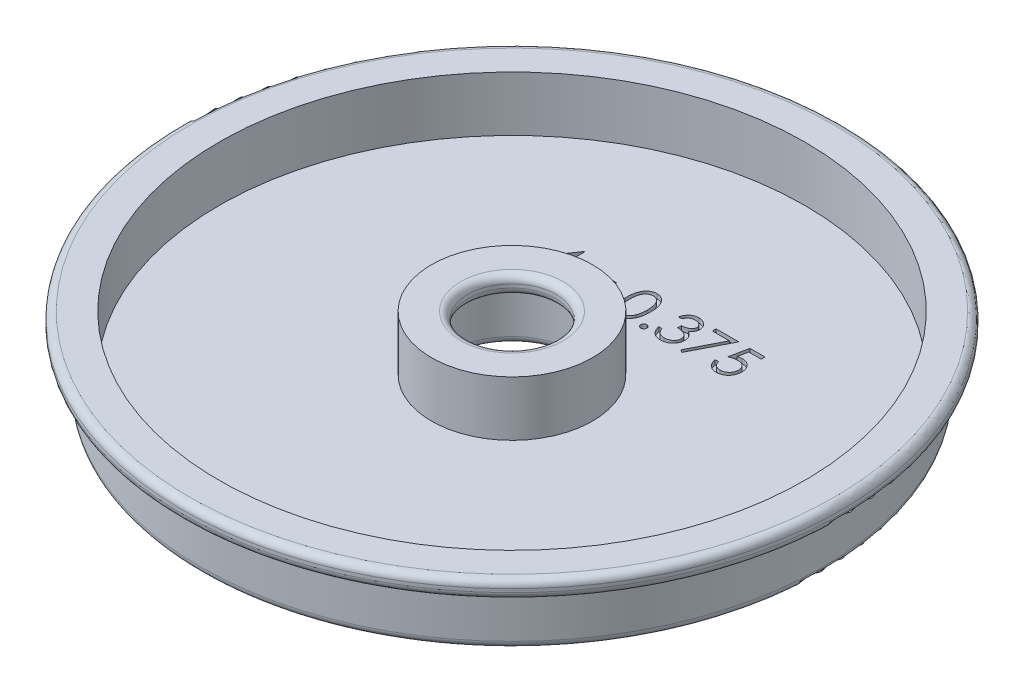
from build123d import *

# Parameters (mm, degrees)
CUT_EXTRUDE1_DEPTH = 0.79375


with BuildPart() as part:
    # Sketch1 → Revolve2 (revolve)
    with BuildSketch(Plane.XY):
        with BuildLine():
            Line((13.97, 6.386825196), (13.97, 15.911825196))
            Line((13.97, 15.911825196), (8.89, 15.911825196))
            ThreePointArc((8.89, 15.911825196), (7.991974388, 15.539850808), (7.62, 14.641825196))
            Line((7.62, 14.641825196), (7.62, 14.006825196))
            ThreePointArc((7.62, 14.006825196), (7.991974388, 13.108799584), (8.89, 12.736825196))
            Line((8.89, 12.736825196), (9.525, 12.736825196))
            ThreePointArc((9.525, 12.736825196), (10.423025612, 12.364850808), (10.795, 11.466825196))
            Line((10.795, 11.466825196), (10.795, 4.481825196))
            ThreePointArc((10.795, 4.481825196), (11.166974388, 3.583799584), (12.065, 3.211825196))
            Line((12.065, 3.211825196), (52.705, 3.211825196))
            ThreePointArc((52.705, 3.211825196), (53.603025612, 3.583799584), (53.975, 4.481825196))
            Line((53.975, 4.481825196), (53.975, 11.503650391))
            ThreePointArc((53.975, 11.503650391), (54.346974388, 12.401676004), (55.245, 12.773650391))
            Line((55.245, 12.773650391), (55.88, 12.773650391))
            ThreePointArc((55.88, 12.773650391), (56.778025612, 13.145624779), (57.15, 14.043650391))
            Line((57.15, 14.043650391), (57.15, 14.641825196))
            ThreePointArc((57.15, 14.641825196), (56.778025612, 15.539850808), (55.88, 15.911825196))
            Line((55.88, 15.911825196), (50.8, 15.911825196))
            Line((50.8, 15.911825196), (50.8, 6.386825196))
            Line((50.8, 6.386825196), (13.97, 6.386825196))
        make_face()
    revolve(axis=Axis((0, 0, 0), (0, 1, 0)))

    # Sketch2 → Cut-Extrude1 (cut)
    # profile 1 of 7: a face of its own
    with BuildSketch(Plane(origin=(0, 6.386825196, 0), x_dir=(1, 0, 0), z_dir=(0, 1, 0))):
        Polygon((-12.245035979, 24.737791059), (-12.129280771, 24.737791059), (-12.129280771, 20.341637213), (-11.396588463, 20.341637213), (-11.396588463, 19.690355162), (-12.129280771, 19.690355162), (-12.129280771, 18.224970546), (-12.699152566, 18.224970546), (-12.699152566, 19.690355162), (-15.711332053, 19.690355162), align=None)
        Polygon((-12.699152566, 20.341637213), (-12.699152566, 23.099409649), (-14.591941027, 20.341637213), align=None, mode=Mode.SUBTRACT)
    # profile 2 of 7: a face of its own
    with BuildSketch(Plane(origin=(0, 6.386825196, 0), x_dir=(1, 0, 0), z_dir=(0, 1, 0))):
        Polygon((-8.384408976, 22.865355162), (-7.706414185, 22.865355162), (-6.511973079, 21.191356764), (-5.317531973, 22.865355162), (-4.639537181, 22.865355162), (-6.172339665, 20.716887614), (-4.395306412, 18.224970546), (-5.073301204, 18.224970546), (-6.511973079, 20.241146428), (-7.950644954, 18.224970546), (-8.628639745, 18.224970546), (-6.850334457, 20.716887614), align=None)
    # profile 3 of 7: a face of its own
    with BuildSketch(Plane(origin=(0, 6.386825196, 0), x_dir=(1, 0, 0), z_dir=(0, 1, 0))):
        with BuildLine():
            add(Edge.make_bspline(
                [(-1.708767951, 21.397426476), (-1.708172832, 21.499203165), (-1.707016805, 21.696905851), (-1.694156384, 21.984986558), (-1.672792549, 22.255243083), (-1.643514744, 22.50768836), (-1.607885837, 22.742387561), (-1.560323454, 22.958713478), (-1.506234512, 23.157667335), (-1.443546504, 23.339897909), (-1.372811515, 23.507860313), (-1.295823642, 23.664660321), (-1.209527515, 23.810060684), (-1.118855116, 23.946382104), (-1.020136071, 24.071393093), (-0.916179694, 24.186859066), (-0.802928576, 24.290111428), (-0.684232547, 24.384175434), (-0.559016961, 24.466633761), (-0.430850981, 24.539264587), (-0.298852432, 24.601312917), (-0.162660929, 24.650099851), (-0.023500574, 24.690396673), (0.119115104, 24.717953764), (0.265421579, 24.735292726), (0.364175753, 24.73695038), (0.414258892, 24.737791059)],
                knots=[0, 0, 0, 0, 1.646270934, 3.197905019, 4.663502075, 6.030701355, 7.308322542, 8.50163776, 9.611534131, 10.641858119, 11.616356847, 12.558055219, 13.465016945, 14.349605745, 15.204443733, 16.039544428, 16.859896111, 17.680448484, 18.487036065, 19.28249412, 20.06191084, 20.843045899, 21.620316918, 22.403196591, 23.190181807, 24, 24, 24, 24], degree=3))
            add(Edge.make_bspline(
                [(0.414258892, 24.737791059), (0.464760403, 24.736906023), (0.565192019, 24.735145965), (0.713673843, 24.718229669), (0.858725409, 24.690160631), (0.999728317, 24.65038972), (1.137840793, 24.601048993), (1.271982561, 24.539205223), (1.402986838, 24.467216421), (1.528771788, 24.382627386), (1.650718304, 24.288316685), (1.765831037, 24.181704415), (1.874120464, 24.063867067), (1.976945661, 23.936065399), (2.071389388, 23.795848174), (2.161329758, 23.645654146), (2.241833308, 23.48285672), (2.319366219, 23.310172157), (2.386289752, 23.122822376), (2.446644226, 22.921863453), (2.495410354, 22.704921714), (2.536030891, 22.473135384), (2.567499488, 22.225653236), (2.59041871, 21.963005777), (2.602525593, 21.685020212), (2.604805608, 21.494959542), (2.605975639, 21.397426476)],
                knots=[0, 0, 0, 0, 0.810914788, 1.612654377, 2.396697861, 3.181598691, 3.963628158, 4.749916497, 5.551656086, 6.361998678, 7.18212741, 8.025565596, 8.878627764, 9.750805457, 10.657531673, 11.591944965, 12.560506719, 13.57287815, 14.630710178, 15.753379473, 16.941251878, 18.199788006, 19.531962791, 20.947069417, 22.433333509, 24, 24, 24, 24], degree=3))
            add(Edge.make_bspline(
                [(2.605975639, 21.397426476), (2.604793479, 21.300318814), (2.602490087, 21.111108496), (2.590554433, 20.834373726), (2.567043774, 20.573120134), (2.537634224, 20.326721152), (2.496901762, 20.096202329), (2.446818104, 19.880765972), (2.391209661, 19.679481728), (2.322566534, 19.49399857), (2.247435674, 19.321729016), (2.165692675, 19.160861475), (2.078117419, 19.009974058), (1.982706411, 18.870274517), (1.881009504, 18.74077324), (1.770850087, 18.623756124), (1.655333454, 18.516403619), (1.533028071, 18.420878524), (1.405281399, 18.337267521), (1.274727074, 18.262493821), (1.13904865, 18.202200217), (1.001320864, 18.1504295), (0.859573686, 18.110877252), (0.713983806, 18.083528971), (0.565291778, 18.064348617), (0.46477751, 18.062885432), (0.414258892, 18.062150033)],
                knots=[0, 0, 0, 0, 1.561518951, 3.042555995, 4.452378317, 5.7783523, 7.031515105, 8.214008947, 9.334062868, 10.386615937, 11.391082383, 12.354592575, 13.286541444, 14.194233754, 15.072674879, 15.931287219, 16.775624067, 17.606195743, 18.42308326, 19.229000347, 20.022332153, 20.807536673, 21.593273796, 22.3848459, 23.188221202, 24, 24, 24, 24], degree=3))
            add(Edge.make_bspline(
                [(0.414258892, 18.062150033), (0.364177143, 18.062996136), (0.265425708, 18.064664484), (0.119099165, 18.081925111), (-0.022927554, 18.109675524), (-0.161355294, 18.148531363), (-0.296894257, 18.196092566), (-0.42769752, 18.258057106), (-0.55521946, 18.329420345), (-0.679119855, 18.410692038), (-0.79707049, 18.503804235), (-0.909735102, 18.606790873), (-1.014283351, 18.722221919), (-1.111590925, 18.848274723), (-1.204072485, 18.983789605), (-1.289143205, 19.130616796), (-1.367830326, 19.288174104), (-1.439754945, 19.457479456), (-1.503524663, 19.641003397), (-1.559854076, 19.840845478), (-1.604329762, 20.05876956), (-1.642398838, 20.293025355), (-1.673104504, 20.544619486), (-1.694067351, 20.81368854), (-1.707023737, 21.100064848), (-1.708175937, 21.296497153), (-1.708767951, 21.397426476)],
                knots=[0, 0, 0, 0, 0.810891512, 1.598919785, 2.382837074, 3.152667961, 3.926044502, 4.706494248, 5.493654104, 6.291793342, 7.103789334, 7.925228297, 8.761435821, 9.622817696, 10.50288917, 11.416980706, 12.369136599, 13.353924996, 14.394355917, 15.514179734, 16.714354668, 17.994756427, 19.357759367, 20.818452758, 22.365282078, 24, 24, 24, 24], degree=3))
        make_face()
        with BuildLine():
            add(Edge.make_bspline(
                [(-1.138896156, 21.399970546), (-1.138679445, 21.31515505), (-1.138258851, 21.150544826), (-1.127271173, 20.911343481), (-1.112302895, 20.68824017), (-1.092996541, 20.480951611), (-1.064325477, 20.290179445), (-1.032200305, 20.114611592), (-0.993105914, 19.955177176), (-0.946850667, 19.810782148), (-0.894165449, 19.678975981), (-0.836641953, 19.556328062), (-0.77484607, 19.441389549), (-0.70568704, 19.335192859), (-0.630366854, 19.237391676), (-0.550586798, 19.146254966), (-0.463369395, 19.064980442), (-0.342712605, 18.967504577), (-0.183424716, 18.866777006), (0.017272396, 18.779063386), (0.223499443, 18.723940929), (0.363473854, 18.716930972), (0.433339421, 18.713432085)],
                knots=[0, 0, 0, 0, 1.459021318, 2.831673884, 4.118529203, 5.306027144, 6.411944654, 7.436330062, 8.375795394, 9.233974572, 10.042671642, 10.816086306, 11.563610507, 12.285937304, 12.993564865, 13.685989202, 14.367179055, 15.041617293, 16.353048772, 17.594441528, 18.799311195, 20, 20, 20, 20], degree=3))
            add(Edge.make_bspline(
                [(0.433339421, 18.713432085), (0.503656911, 18.716330916), (0.644146712, 18.722122592), (0.84940374, 18.778000302), (1.04866723, 18.862309323), (1.204826322, 18.961999797), (1.323630365, 19.056938338), (1.40875119, 19.137882057), (1.486878049, 19.228516273), (1.560977242, 19.326304996), (1.628938708, 19.433116503), (1.690738972, 19.548437175), (1.747133046, 19.672587255), (1.779262315, 19.75925521), (1.795689181, 19.803566299)],
                knots=[0, 0, 0, 0, 1.353760809, 2.704726607, 4.075137775, 5.516104923, 6.260822281, 7.007110065, 7.778089737, 8.566572457, 9.372053459, 10.217411131, 11.088608312, 12, 12, 12, 12], degree=3))
            add(Edge.make_bspline(
                [(1.795689181, 19.803566299), (1.814833102, 19.86022597), (1.853703473, 19.975269399), (1.903799121, 20.153729168), (1.943251488, 20.340968468), (1.978745023, 20.535868323), (2.002971282, 20.739866066), (2.022470886, 20.952330505), (2.033956561, 21.173421834), (2.035380323, 21.323635604), (2.036103844, 21.399970546)],
                knots=[0, 0, 0, 0, 0.884706709, 1.796334032, 2.740027952, 3.714592787, 4.726048262, 5.777819803, 6.87074269, 8, 8, 8, 8], degree=3))
            add(Edge.make_bspline(
                [(2.036103844, 21.399970546), (2.035105644, 21.476293142), (2.03315295, 21.625596455), (2.025689001, 21.844250869), (2.006414802, 22.051928092), (1.985007829, 22.249522807), (1.953444299, 22.435941213), (1.919412278, 22.61274391), (1.873690079, 22.777740541), (1.824849916, 22.933514353), (1.768951055, 23.078295541), (1.707418223, 23.212759125), (1.641701604, 23.337554268), (1.570323539, 23.452338576), (1.494131371, 23.55762619), (1.411114103, 23.651306097), (1.324564741, 23.736281739), (1.203339275, 23.833278115), (1.044635921, 23.932177905), (0.847158818, 24.023192926), (0.641653506, 24.0754594), (0.502727382, 24.082828461), (0.433339421, 24.086509008)],
                knots=[0, 0, 0, 0, 1.31362396, 2.569729283, 3.763502607, 4.902122613, 5.988968491, 7.01645872, 7.998833611, 8.933434873, 9.825090667, 10.667526885, 11.477055099, 12.250526234, 12.991942729, 13.710640831, 14.402115721, 15.076753259, 16.378508321, 17.609869233, 18.806226677, 20, 20, 20, 20], degree=3))
            add(Edge.make_bspline(
                [(0.433339421, 24.086509008), (0.363107347, 24.082823383), (0.222515253, 24.07544542), (0.014873963, 24.02338766), (-0.184161075, 23.93264985), (-0.342444757, 23.832950546), (-0.46375477, 23.737993895), (-0.549176228, 23.6556499), (-0.629269998, 23.56557741), (-0.703052825, 23.466876793), (-0.772157667, 23.360803912), (-0.835623219, 23.246524296), (-0.89280466, 23.123458821), (-0.945572318, 22.991711859), (-0.991968662, 22.847329289), (-1.030239138, 22.688091258), (-1.06559422, 22.513081825), (-1.09062278, 22.321276432), (-1.112872737, 22.113935954), (-1.127171754, 21.890275677), (-1.138295606, 21.650673158), (-1.138691963, 21.485211828), (-1.138896156, 21.399970546)],
                knots=[0, 0, 0, 0, 1.207732386, 2.417664972, 3.655092373, 4.956220595, 5.625982001, 6.301752483, 6.994047911, 7.697131622, 8.419323945, 9.170223765, 9.943494443, 10.752040957, 11.610060368, 12.549350801, 13.567764191, 14.679664412, 15.874934091, 17.154273443, 18.533957287, 20, 20, 20, 20], degree=3))
        make_face(mode=Mode.SUBTRACT)
    # profile 4 of 7: a face of its own
    with BuildSketch(Plane(origin=(0, 6.386825196, 0), x_dir=(1, 0, 0), z_dir=(0, 1, 0))):
        with BuildLine():
            add(Edge.make_bspline(
                [(4.193475639, 19.201893623), (4.228836453, 19.199792378), (4.298157194, 19.195673132), (4.398376755, 19.167412596), (4.489081352, 19.117231883), (4.569875567, 19.050352271), (4.636471603, 18.969261568), (4.688440642, 18.879280419), (4.716455001, 18.778221815), (4.720544241, 18.708499405), (4.722642306, 18.672726957)],
                knots=[0, 0, 0, 0, 1.020151414, 1.999887582, 2.974338812, 3.990962822, 5.007586832, 5.987933904, 6.967670073, 8, 8, 8, 8], degree=3))
            add(Edge.make_bspline(
                [(4.722642306, 18.672726957), (4.720473145, 18.637814058), (4.71619559, 18.568966336), (4.688504858, 18.468669968), (4.636075539, 18.378632584), (4.570334909, 18.296441562), (4.489061379, 18.229420268), (4.398162315, 18.179666485), (4.298392461, 18.149382465), (4.228875703, 18.145524754), (4.193475639, 18.14356029)],
                knots=[0, 0, 0, 0, 1.009421747, 1.99056486, 2.972319754, 3.999869655, 5.017953583, 5.993804169, 6.978383603, 8, 8, 8, 8], degree=3))
            add(Edge.make_bspline(
                [(4.193475639, 18.14356029), (4.158050068, 18.145453673), (4.088890072, 18.149150054), (3.989492625, 18.180288288), (3.898039982, 18.228953709), (3.816782277, 18.29656653), (3.75049105, 18.378209648), (3.700370712, 18.46929005), (3.670271442, 18.568679229), (3.666312902, 18.63775751), (3.664308973, 18.672726957)],
                knots=[0, 0, 0, 0, 1.022052826, 1.995314843, 2.982371812, 4.00089066, 5.028879526, 6.005146991, 6.990147033, 8, 8, 8, 8], degree=3))
            add(Edge.make_bspline(
                [(3.664308973, 18.672726957), (3.666235924, 18.708557974), (3.66999806, 18.778513638), (3.700433901, 18.87866059), (3.750102171, 18.969680473), (3.817240531, 19.050228554), (3.898020325, 19.117696946), (3.989272011, 19.166800213), (4.089129463, 19.195902104), (4.158090351, 19.199861813), (4.193475639, 19.201893623)],
                knots=[0, 0, 0, 0, 1.032775665, 2.016367738, 2.991239715, 4.008302682, 5.025365648, 6.011011707, 6.979408107, 8, 8, 8, 8], degree=3))
        make_face()
    # profile 5 of 7: a face of its own
    with BuildSketch(Plane(origin=(0, 6.386825196, 0), x_dir=(1, 0, 0), z_dir=(0, 1, 0))):
        with BuildLine():
            Line((6.350847434, 23.109585931), (5.780975639, 23.109585931))
            add(Edge.make_bspline(
                [(5.780975639, 23.109585931), (5.796414395, 23.173507723), (5.826595901, 23.298469599), (5.889547213, 23.477008486), (5.958125862, 23.645961161), (6.040474666, 23.802164038), (6.130297691, 23.948756333), (6.233208915, 24.082413173), (6.344460411, 24.206533839), (6.467514248, 24.316684998), (6.596561962, 24.416430307), (6.733421915, 24.501475054), (6.875340594, 24.574634588), (7.023301278, 24.63490558), (7.177744475, 24.68030903), (7.337273935, 24.713250663), (7.502307713, 24.734643113), (7.614335485, 24.736730926), (7.67122003, 24.737791059)],
                knots=[0, 0, 0, 0, 1.162005537, 2.271625781, 3.343758855, 4.383309926, 5.390229558, 6.379919256, 7.361854164, 8.333198761, 9.295911338, 10.242430842, 11.177959212, 12.116337295, 13.062827104, 14.020064771, 14.994644689, 16, 16, 16, 16], degree=3))
            add(Edge.make_bspline(
                [(7.67122003, 24.737791059), (7.754101577, 24.735288741), (7.918056782, 24.730338689), (8.158926882, 24.685136783), (8.391204111, 24.613608328), (8.612346032, 24.514777423), (8.817756616, 24.392880441), (9.000520841, 24.247801561), (9.158161425, 24.082339971), (9.290412653, 23.899582319), (9.393963008, 23.704264466), (9.470319714, 23.503241324), (9.516804764, 23.296989747), (9.522829203, 23.157730112), (9.525847434, 23.087961332)],
                knots=[0, 0, 0, 0, 1.083050992, 2.142477498, 3.193116406, 4.255571735, 5.30263384, 6.308962982, 7.297363603, 8.282367274, 9.249857812, 10.179914175, 11.08814088, 12, 12, 12, 12], degree=3))
            add(Edge.make_bspline(
                [(9.525847434, 23.087961332), (9.523736347, 23.020820433), (9.519605279, 22.889436112), (9.484528413, 22.69762711), (9.425498336, 22.516848778), (9.343728909, 22.346340099), (9.237880668, 22.187182175), (9.109660204, 22.039016916), (8.958162518, 21.901187157), (8.843356444, 21.822230399), (8.78425088, 21.781581123)],
                knots=[0, 0, 0, 0, 1.024540389, 2.004866551, 2.965041327, 3.920577974, 4.882998113, 5.874504559, 6.905732034, 8, 8, 8, 8], degree=3))
            add(Edge.make_bspline(
                [(8.78425088, 21.781581123), (8.85179992, 21.748963583), (8.985634106, 21.684338803), (9.168061495, 21.5576005), (9.333665641, 21.411266841), (9.426019531, 21.297070885), (9.472421953, 21.239694104)],
                knots=[0, 0, 0, 0, 1.015518401, 2.012035669, 3.001164323, 4, 4, 4, 4], degree=3))
            add(Edge.make_bspline(
                [(9.472421953, 21.239694104), (9.50297696, 21.197860755), (9.563586614, 21.114879106), (9.638399654, 20.981463019), (9.706270476, 20.846568174), (9.759157302, 20.706578966), (9.800112747, 20.563117927), (9.829388119, 20.415938723), (9.847574775, 20.264921168), (9.850179276, 20.162754239), (9.85148846, 20.111398832)],
                knots=[0, 0, 0, 0, 1.025084078, 2.033381695, 3.024893161, 4.013698104, 4.991890475, 5.976764909, 6.982997093, 8, 8, 8, 8], degree=3))
            add(Edge.make_bspline(
                [(9.85148846, 20.111398832), (9.848232699, 20.022481195), (9.841736501, 19.845064368), (9.783671966, 19.582945945), (9.693659372, 19.326722534), (9.56583036, 19.081658182), (9.410042165, 18.852368063), (9.224699591, 18.64721533), (9.011908536, 18.470869291), (8.774589716, 18.323530734), (8.517474354, 18.205751076), (8.242472923, 18.124004001), (7.953547825, 18.070761973), (7.755414585, 18.065052654), (7.654683572, 18.062150033)],
                knots=[0, 0, 0, 0, 0.955779014, 1.907060117, 2.875433937, 3.871313158, 4.872415639, 5.851225146, 6.836215519, 7.83643374, 8.849228613, 9.86973379, 10.916971861, 12, 12, 12, 12], degree=3))
            add(Edge.make_bspline(
                [(7.654683572, 18.062150033), (7.58679427, 18.06372522), (7.453210762, 18.066824663), (7.256826129, 18.088012982), (7.069371046, 18.126711706), (6.890592062, 18.178787703), (6.720330353, 18.244812721), (6.559105476, 18.327033787), (6.405925526, 18.423756084), (6.262236001, 18.536121307), (6.128054028, 18.661817452), (6.006945514, 18.803075942), (5.896891318, 18.957285517), (5.800838245, 19.126237348), (5.714411203, 19.307748029), (5.643325753, 19.504141733), (5.580759078, 19.713662745), (5.551669793, 19.859672359), (5.53674487, 19.934585931)],
                knots=[0, 0, 0, 0, 1.048658725, 2.063410685, 3.046034179, 4.001477787, 4.936774919, 5.862367409, 6.792675028, 7.730719943, 8.675894397, 9.627829632, 10.600096036, 11.597688215, 12.626045268, 13.701542398, 14.82072376, 16, 16, 16, 16], degree=3))
            Line((5.53674487, 19.934585931), (6.106616665, 19.934585931))
            add(Edge.make_bspline(
                [(6.106616665, 19.934585931), (6.121463494, 19.885692721), (6.150341865, 19.790591181), (6.199498663, 19.653720912), (6.255502528, 19.528248444), (6.315581799, 19.413253352), (6.378679836, 19.307603136), (6.449282629, 19.214091459), (6.522160935, 19.128611021), (6.577096334, 19.08045151), (6.60398245, 19.056881604)],
                knots=[0, 0, 0, 0, 1.198163088, 2.33053128, 3.407730985, 4.417276592, 5.372219308, 6.28897303, 7.162600585, 8, 8, 8, 8], degree=3))
            add(Edge.make_bspline(
                [(6.60398245, 19.056881604), (6.639536239, 19.02947077), (6.71053407, 18.974733712), (6.826227861, 18.904880757), (6.947902726, 18.844354326), (7.078195063, 18.798119621), (7.21429329, 18.758971579), (7.358397224, 18.733352923), (7.509235517, 18.715775812), (7.61222846, 18.714224722), (7.664859854, 18.713432085)],
                knots=[0, 0, 0, 0, 0.946170439, 1.889420265, 2.845303464, 3.807233317, 4.801018734, 5.828864929, 6.890507805, 8, 8, 8, 8], degree=3))
            add(Edge.make_bspline(
                [(7.664859854, 18.713432085), (7.724284066, 18.714549513), (7.840482982, 18.716734547), (8.010036799, 18.736829044), (8.171340311, 18.766094222), (8.322602619, 18.811293491), (8.465805111, 18.86713875), (8.598940389, 18.937258), (8.723756182, 19.019526281), (8.838653818, 19.11303304), (8.941969238, 19.215397753), (9.032936641, 19.322464324), (9.110269955, 19.433781329), (9.17265159, 19.549964777), (9.221910446, 19.67053355), (9.255444252, 19.795825997), (9.278760573, 19.924816752), (9.280659426, 20.01249931), (9.281616665, 20.056701316)],
                knots=[0, 0, 0, 0, 1.217147791, 2.380027433, 3.494444702, 4.572153297, 5.609568379, 6.639424714, 7.649109417, 8.668170816, 9.669597737, 10.625200337, 11.543417969, 12.441394052, 13.322311151, 14.205496177, 15.095365482, 16, 16, 16, 16], degree=3))
            add(Edge.make_bspline(
                [(9.281616665, 20.056701316), (9.278840261, 20.115867602), (9.273301267, 20.233905771), (9.231012845, 20.407564799), (9.161455191, 20.574884418), (9.06407792, 20.733009923), (8.945540241, 20.879560487), (8.806992482, 21.010318748), (8.647284124, 21.118214485), (8.500290934, 21.192761047), (8.370088435, 21.243628312), (8.258663381, 21.277510034), (8.133919257, 21.306200523), (7.997364596, 21.332892787), (7.847970475, 21.35561009), (7.685899537, 21.374554527), (7.511118941, 21.389712959), (7.390122112, 21.396482232), (7.327770511, 21.399970546)],
                knots=[0, 0, 0, 0, 1.07054697, 2.135767047, 3.216561865, 4.33974944, 5.486079747, 6.621378074, 7.775625952, 8.963672916, 9.598146892, 10.304877434, 11.070270905, 11.915000392, 12.823868403, 13.805723172, 14.86925407, 16, 16, 16, 16], degree=3))
            Line((7.327770511, 21.399970546), (7.327770511, 22.051252598))
            add(Edge.make_bspline(
                [(7.327770511, 22.051252598), (7.406331197, 22.052585741), (7.560212283, 22.055197043), (7.78499195, 22.086780147), (7.999936388, 22.130469287), (8.200282049, 22.197389564), (8.382887571, 22.275114103), (8.541310278, 22.365560254), (8.673330674, 22.466098442), (8.778307189, 22.578280462), (8.857281647, 22.698594905), (8.915024551, 22.82399227), (8.949133714, 22.955571638), (8.953686967, 23.045369107), (8.955975639, 23.090505402)],
                knots=[0, 0, 0, 0, 1.321986639, 2.589447074, 3.816329219, 5.01088745, 6.139805852, 7.153945165, 8.075214402, 8.924034688, 9.728124013, 10.488707548, 11.240355623, 12, 12, 12, 12], degree=3))
            add(Edge.make_bspline(
                [(8.955975639, 23.090505402), (8.955223779, 23.123666454), (8.95372799, 23.189638794), (8.934864357, 23.286022847), (8.906517883, 23.379460278), (8.867547517, 23.469553733), (8.815386442, 23.555678373), (8.752964152, 23.638568459), (8.678636313, 23.717750744), (8.593463859, 23.791556466), (8.502002442, 23.86189494), (8.401763564, 23.921609681), (8.295769591, 23.972672865), (8.183903175, 24.014781533), (8.065801284, 24.04645767), (7.942018815, 24.069201268), (7.812319732, 24.083421013), (7.723833875, 24.085468282), (7.678852242, 24.086509008)],
                knots=[0, 0, 0, 0, 0.884392785, 1.759457502, 2.611959086, 3.489218968, 4.37281399, 5.2945488, 6.255912374, 7.266815255, 8.301784654, 9.332968512, 10.37626691, 11.440494194, 12.520033166, 13.637162961, 14.798855837, 16, 16, 16, 16], degree=3))
            add(Edge.make_bspline(
                [(7.678852242, 24.086509008), (7.60654993, 24.08398468), (7.465326698, 24.07905408), (7.261736778, 24.035868612), (7.0724717, 23.966965518), (6.927802977, 23.884718468), (6.820973164, 23.803528396), (6.744633576, 23.73262178), (6.669666364, 23.653822229), (6.601003493, 23.562276319), (6.531563564, 23.464183714), (6.468345574, 23.354557892), (6.406914418, 23.236258491), (6.369898363, 23.15262784), (6.350847434, 23.109585931)],
                knots=[0, 0, 0, 0, 1.472543308, 2.876219568, 4.221790263, 5.565193594, 6.249813518, 6.953379497, 7.687249741, 8.463570142, 9.283606569, 10.136032583, 11.040678096, 12, 12, 12, 12], degree=3))
        make_face()
    # profile 6 of 7: a face of its own
    with BuildSketch(Plane(origin=(0, 6.386825196, 0), x_dir=(1, 0, 0), z_dir=(0, 1, 0))):
        Polygon((10.828411537, 24.574970546), (14.736103844, 24.574970546), (11.398283331, 18.062150033), (10.906005687, 18.333093543), (13.77190112, 23.923688495), (10.828411537, 23.923688495), align=None)
    # profile 7 of 7: a face of its own
    with BuildSketch(Plane(origin=(0, 6.386825196, 0), x_dir=(1, 0, 0), z_dir=(0, 1, 0))):
        with BuildLine():
            Line((19.295078203, 24.574970546), (19.295078203, 23.923688495))
            Line((19.295078203, 23.923688495), (17.135162338, 23.923688495))
            Line((17.135162338, 23.923688495), (16.792984854, 22.253506203))
            add(Edge.make_bspline(
                [(16.792984854, 22.253506203), (16.860214797, 22.272066839), (16.99046218, 22.308025136), (17.182703642, 22.347949891), (17.36520664, 22.372017197), (17.483634812, 22.375303431), (17.540941585, 22.376893623)],
                knots=[0, 0, 0, 0, 1.100273476, 2.13160584, 3.095893838, 4, 4, 4, 4], degree=3))
            add(Edge.make_bspline(
                [(17.540941585, 22.376893623), (17.611850655, 22.375358854), (17.751275605, 22.372341115), (17.95527198, 22.343363616), (18.150004515, 22.297752629), (18.335065958, 22.234033968), (18.510798671, 22.15255488), (18.675585818, 22.05077356), (18.831900889, 21.931877373), (18.976939595, 21.795179995), (19.108519412, 21.64473649), (19.224209136, 21.482978638), (19.32247555, 21.311478451), (19.401507205, 21.128597347), (19.464615926, 20.936357168), (19.506620259, 20.732735197), (19.534590574, 20.519650751), (19.537715475, 20.373955317), (19.539308973, 20.299660049)],
                knots=[0, 0, 0, 0, 1.052922333, 2.070308379, 3.05430497, 4.020497103, 4.973039431, 5.925935799, 6.892292201, 7.88610001, 8.88166317, 9.857072816, 10.836096531, 11.812156883, 12.81219415, 13.836441305, 14.89672472, 16, 16, 16, 16], degree=3))
            add(Edge.make_bspline(
                [(19.539308973, 20.299660049), (19.538102336, 20.247912593), (19.535705369, 20.145117001), (19.523515932, 19.99245538), (19.500046847, 19.843025668), (19.468536833, 19.696808043), (19.427638446, 19.554079325), (19.378128306, 19.414430981), (19.31753837, 19.278732195), (19.251078589, 19.145698978), (19.176245693, 19.018338829), (19.093190402, 18.899232811), (19.005441582, 18.786594186), (18.91102364, 18.681630985), (18.809058977, 18.585032938), (18.700782466, 18.49622677), (18.587058104, 18.413710642), (18.46612645, 18.340834059), (18.340682231, 18.273772696), (18.208913894, 18.218757136), (18.073820909, 18.169570892), (17.933458921, 18.130365035), (17.78814586, 18.099644543), (17.637642196, 18.078779167), (17.482737267, 18.063581917), (17.377735458, 18.062630583), (17.324695591, 18.062150033)],
                knots=[0, 0, 0, 0, 1.056347294, 2.098418968, 3.122841568, 4.141288669, 5.149314143, 6.15115421, 7.162517403, 8.180376062, 9.185164535, 10.17417709, 11.141909838, 12.097768115, 13.052685741, 14.0056014, 14.954263652, 15.917497458, 16.885230207, 17.854509472, 18.828990115, 19.81800267, 20.826176721, 21.857883937, 22.917946725, 24, 24, 24, 24], degree=3))
            add(Edge.make_bspline(
                [(17.324695591, 18.062150033), (17.261423863, 18.063403411), (17.136944213, 18.065869283), (16.954571184, 18.091665678), (16.779103257, 18.12861164), (16.611952931, 18.184194587), (16.451622209, 18.253840107), (16.300269564, 18.341862304), (16.154027656, 18.441610107), (16.018841532, 18.559321604), (15.893372584, 18.687982913), (15.781056489, 18.827606062), (15.681028428, 18.975886621), (15.59489023, 19.133544701), (15.521415249, 19.300166036), (15.46369377, 19.476374909), (15.417105897, 19.66125063), (15.397396549, 19.788529142), (15.387385896, 19.853175674)],
                knots=[0, 0, 0, 0, 1.0467383, 2.05933395, 3.04377827, 4.011590433, 4.970194871, 5.932262533, 6.905835911, 7.896367577, 8.894135286, 9.877477877, 10.858688626, 11.851381753, 12.8477658, 13.868841284, 14.917554742, 16, 16, 16, 16], degree=3))
            Line((15.387385896, 19.853175674), (15.95725769, 19.853175674))
            add(Edge.make_bspline(
                [(15.95725769, 19.853175674), (15.971279502, 19.792621254), (15.998230202, 19.676232294), (16.057386346, 19.512708289), (16.129714434, 19.366986269), (16.215719466, 19.237138597), (16.318317379, 19.123910845), (16.4353922, 19.023005604), (16.56665164, 18.931973583), (16.712507928, 18.856095134), (16.866383086, 18.791381824), (17.027432167, 18.748289464), (17.191270053, 18.717989272), (17.302083668, 18.714956221), (17.357768508, 18.713432085)],
                knots=[0, 0, 0, 0, 1.136247022, 2.183929868, 3.172523383, 4.106158343, 5.02341133, 5.958108904, 6.928429099, 7.938127109, 8.96079061, 9.975095812, 10.982467395, 12, 12, 12, 12], degree=3))
            add(Edge.make_bspline(
                [(17.357768508, 18.713432085), (17.412121686, 18.71492121), (17.519143537, 18.717853311), (17.676644196, 18.740421233), (17.828704696, 18.775178541), (17.973824615, 18.827193849), (18.114543408, 18.890412124), (18.247301535, 18.971538047), (18.375939612, 19.064901224), (18.496459225, 19.171865395), (18.606839369, 19.289738984), (18.704368332, 19.415790826), (18.785606446, 19.550259962), (18.854066901, 19.690818397), (18.906052171, 19.839006636), (18.943137952, 19.994130197), (18.96491493, 20.156572232), (18.967910642, 20.267369409), (18.969437178, 20.323828719)],
                knots=[0, 0, 0, 0, 1.027316725, 2.022795036, 3.002884548, 3.971462791, 4.93288096, 5.914575861, 6.907176829, 7.935150275, 8.956128384, 9.956726525, 10.942570165, 11.921478529, 12.907843606, 13.90538589, 14.932640048, 16, 16, 16, 16], degree=3))
            add(Edge.make_bspline(
                [(18.969437178, 20.323828719), (18.968242508, 20.374766154), (18.965904111, 20.474468936), (18.946798648, 20.620336068), (18.913566427, 20.758354302), (18.867440245, 20.889190126), (18.808875995, 21.012966943), (18.737309114, 21.129812495), (18.651396521, 21.238186735), (18.55325838, 21.338140368), (18.445747363, 21.430387498), (18.327013716, 21.509026055), (18.199542134, 21.57518202), (18.064868432, 21.63227396), (17.919789259, 21.673278169), (17.767177655, 21.704062762), (17.605385627, 21.721870634), (17.494767379, 21.724341489), (17.437906729, 21.725611572)],
                knots=[0, 0, 0, 0, 1.045622112, 2.046656509, 3.013763289, 3.955457236, 4.890082067, 5.820317437, 6.762574623, 7.722996705, 8.69280354, 9.665887285, 10.63943826, 11.638615906, 12.663482002, 13.728887084, 14.832589034, 16, 16, 16, 16], degree=3))
            add(Edge.make_bspline(
                [(17.437906729, 21.725611572), (17.388687101, 21.724558214), (17.287061056, 21.722383296), (17.131172499, 21.706369509), (16.967357516, 21.680535361), (16.796244074, 21.645000312), (16.617318295, 21.598498215), (16.430957768, 21.542773336), (16.236770656, 21.476149138), (16.105928499, 21.425834979), (16.038667947, 21.399970546)],
                knots=[0, 0, 0, 0, 0.817624296, 1.688186739, 2.600797293, 3.572016777, 4.590301741, 5.671205678, 6.80286297, 8, 8, 8, 8], degree=3))
            Line((16.038667947, 21.399970546), (16.689949998, 24.574970546))
            Line((16.689949998, 24.574970546), (19.295078203, 24.574970546))
        make_face()
    extrude(amount=-CUT_EXTRUDE1_DEPTH, mode=Mode.SUBTRACT)


solid = part.part
